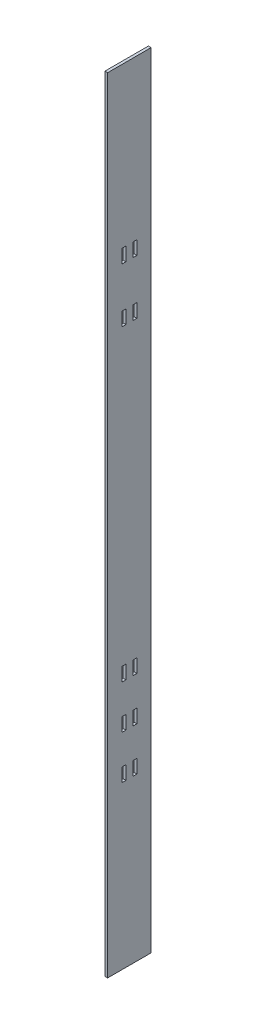
from build123d import *

# Parameters (mm, degrees)
SKETCH1_W                 = 50.8
SKETCH1_H                 = 914.4
BOSS_EXTRUDE1_DEPTH       = 3.175
SKETCH2_W                 = 4.7625
SKETCH2_H                 = 15.875
CUT_EXTRUDE1_DEPTH        = 458.916019184
LPATTERN1_COPY_1_SKETCH_W = 4.7625
LPATTERN1_COPY_1_SKETCH_H = 15.875
LPATTERN1_COPY_1_DEPTH    = 458.916019184
LPATTERN1_COPY_2_SKETCH_W = 4.7625
LPATTERN1_COPY_2_SKETCH_H = 15.875
LPATTERN1_COPY_2_DEPTH    = 458.916019184
LPATTERN1_COPY_3_SKETCH_W = 4.7625
LPATTERN1_COPY_3_SKETCH_H = 15.875
LPATTERN1_COPY_3_DEPTH    = 458.916019184
LPATTERN1_COPY_4_SKETCH_W = 4.7625
LPATTERN1_COPY_4_SKETCH_H = 15.875
LPATTERN1_COPY_4_DEPTH    = 458.916019184
LPATTERN1_COPY_5_SKETCH_W = 4.7625
LPATTERN1_COPY_5_SKETCH_H = 15.875
LPATTERN1_COPY_5_DEPTH    = 458.916019184
LPATTERN1_COPY_6_SKETCH_W = 4.7625
LPATTERN1_COPY_6_SKETCH_H = 15.875
LPATTERN1_COPY_6_DEPTH    = 458.916019184
SKETCH3_W                 = 4.7625
SKETCH3_H                 = 15.875
CUT_EXTRUDE2_DEPTH        = 458.916019184
LPATTERN2_COUNT           = 2
LPATTERN2_PITCH           = 63.5


with BuildPart() as part:
    # Sketch1 → Boss-Extrude1 (new body)
    with BuildSketch(Plane(origin=(0, 0, 0), x_dir=(0, 0, -1), z_dir=(1, 0, 0))):
        Rectangle(SKETCH1_W, SKETCH1_H)
    extrude(amount=BOSS_EXTRUDE1_DEPTH)

    # Sketch2 → Cut-Extrude1 (cut, through all)
    with BuildSketch(Plane(origin=(3.175, 0, 0), x_dir=(0, 0, -1), z_dir=(1, 0, 0))):
        with Locations((6.38125, -209.55)):
            Rectangle(SKETCH2_W, SKETCH2_H)
    cut_extrude1 = extrude(amount=-CUT_EXTRUDE1_DEPTH, mode=Mode.SUBTRACT)

    # Mirror1: Cut-Extrude1 across plane
    add(cut_extrude1.mirror(Plane.XY), mode=Mode.SUBTRACT)

    # LPattern1 copy 1 sketch → LPattern1 copy 1 (cut, through all)
    with BuildSketch(Plane(origin=(3.175, -50.8, 0), x_dir=(0, 0, 1), z_dir=(1, 0, 0))):
        with Locations((6.38125, 209.55)):
            Rectangle(LPATTERN1_COPY_1_SKETCH_W, LPATTERN1_COPY_1_SKETCH_H)
    extrude(amount=-LPATTERN1_COPY_1_DEPTH, mode=Mode.SUBTRACT)

    # LPattern1 copy 2 sketch → LPattern1 copy 2 (cut, through all)
    with BuildSketch(Plane(origin=(3.175, 50.8, 0), x_dir=(0, 0, 1), z_dir=(1, 0, 0))):
        with Locations((6.38125, 209.55)):
            Rectangle(LPATTERN1_COPY_2_SKETCH_W, LPATTERN1_COPY_2_SKETCH_H)
    extrude(amount=-LPATTERN1_COPY_2_DEPTH, mode=Mode.SUBTRACT)

    # LPattern1 copy 3 sketch → LPattern1 copy 3 (cut, through all)
    with BuildSketch(Plane(origin=(3.175, 0, 0), x_dir=(0, 0, 1), z_dir=(1, 0, 0))):
        with Locations((6.38125, 209.55)):
            Rectangle(LPATTERN1_COPY_3_SKETCH_W, LPATTERN1_COPY_3_SKETCH_H)
    extrude(amount=-LPATTERN1_COPY_3_DEPTH, mode=Mode.SUBTRACT)

    # LPattern1 copy 4 sketch → LPattern1 copy 4 (cut, through all)
    with BuildSketch(Plane(origin=(3.175, -50.8, 0), x_dir=(0, 0, -1), z_dir=(1, 0, 0))):
        with Locations((6.38125, -209.55)):
            Rectangle(LPATTERN1_COPY_4_SKETCH_W, LPATTERN1_COPY_4_SKETCH_H)
    extrude(amount=-LPATTERN1_COPY_4_DEPTH, mode=Mode.SUBTRACT)

    # LPattern1 copy 5 sketch → LPattern1 copy 5 (cut, through all)
    with BuildSketch(Plane(origin=(3.175, 50.8, 0), x_dir=(0, 0, -1), z_dir=(1, 0, 0))):
        with Locations((6.38125, -209.55)):
            Rectangle(LPATTERN1_COPY_5_SKETCH_W, LPATTERN1_COPY_5_SKETCH_H)
    extrude(amount=-LPATTERN1_COPY_5_DEPTH, mode=Mode.SUBTRACT)

    # LPattern1 copy 6 sketch → LPattern1 copy 6 (cut, through all)
    with BuildSketch(Plane(origin=(3.175, 0, 0), x_dir=(0, 0, -1), z_dir=(1, 0, 0))):
        with Locations((6.38125, -209.55)):
            Rectangle(LPATTERN1_COPY_6_SKETCH_W, LPATTERN1_COPY_6_SKETCH_H)
    extrude(amount=-LPATTERN1_COPY_6_DEPTH, mode=Mode.SUBTRACT)

    # Sketch3 → Cut-Extrude2 (cut, through all)
    with BuildSketch(Plane(origin=(3.175, 0, 0), x_dir=(0, 0, -1), z_dir=(1, 0, 0))):
        with Locations((6.38125, 200.025)):
            Rectangle(SKETCH3_W, SKETCH3_H)
        with Locations((-6.38125, 200.025)):
            Rectangle(SKETCH3_W, SKETCH3_H)
    cut_extrude2 = extrude(amount=-CUT_EXTRUDE2_DEPTH, mode=Mode.SUBTRACT)

    # LPattern2: Cut-Extrude2 ×2
    with Locations(*[(0, i * LPATTERN2_PITCH, 0) for i in range(1, LPATTERN2_COUNT)]):
        add(cut_extrude2, mode=Mode.SUBTRACT)


solid = part.part
